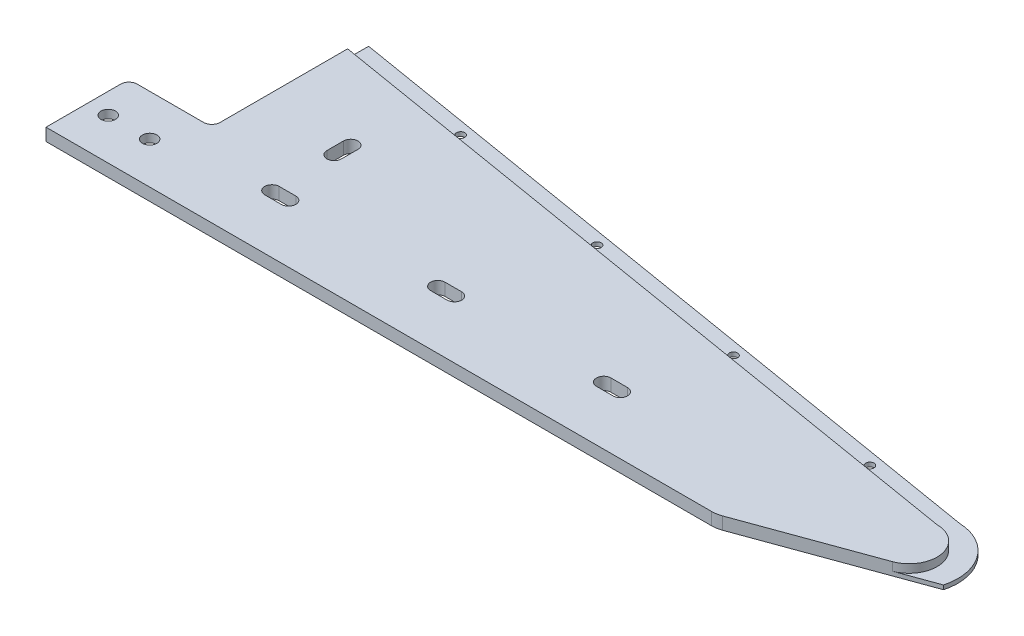
from build123d import *

# Parameters (mm, degrees)
SKETCH_1_W                = 35
SKETCH_1_H                = 55
EXTRUDE_1_DEPTH           = 1
EXTRUDE_2_DEPTH           = 3
SKETCH_3_R                = 5
CUT_EXTRUDE_1_DEPTH       = 169.569903897
SKETCH_4_R                = 4
CUT_EXTRUDE_2_DEPTH       = 2
SKETCH_5_R                = 2
CUT_EXTRUDE_3_DEPTH       = 2
EXTRUDE_START             = 7
EXTRUDE_3_DEPTH           = 7
CUT_EXTRUDE_START         = -1.5
SKETCH_9_W                = 10
SKETCH_9_H                = 26
CUT_EXTRUDE_4_DEPTH       = 168.318874833
SKETCH_10_R               = 1.5
CUT_EXTRUDE_5_DEPTH       = 194.595583627
EXTRUDE_4_DEPTH           = 3
SKETCH_13_W               = 334.012533363
SKETCH_13_H               = 161.456209481
CUT_EXTRUDE_6_DEPTH       = 10
SKETCH_14_R               = 3.5
CUT_EXTRUDE_7_DEPTH       = 2.5
SKETCH_15_R               = 5
CUT_EXTRUDE_8_DEPTH       = 179.854165453
EXTRUDE_START_2           = 16
EXTRUDE_5_DEPTH           = 16
EXTRUDE_6_DEPTH           = 7
SKETCH_19_W               = 10
SKETCH_19_H               = 26
CUT_EXTRUDE_9_DEPTH       = 180.209193181
SKETCH_20_R               = 1.5
CUT_EXTRUDE_10_DEPTH      = 175.844216376
THREAD_1_PITCH            = 0.6
CUT_EXTRUDE_11_DEPTH      = 181.709193232
SKETCH_22_W               = 13
SKETCH_22_H               = 1.5
CUT_EXTRUDE_12_DEPTH      = 7
SKETCH_23_R               = 5
EXTRUDE_7_DEPTH           = 2
CUT_EXTRUDE_START_2       = -3
CUT_EXTRUDE_15_DEPTH      = 177.762490825
SKETCH_25_R               = 7.5
CUT_EXTRUDE_16_DEPTH      = 4
CUT_EXTRUDE_17_DEPTH      = 10
SKETCH_27_R               = 1.75
CUT_EXTRUDE_18_DEPTH      = 10
CUT_EXTRUDE_19_DEPTH      = 180.762490825
CUT_EXTRUDE_19_DEPTH_BACK = 60
CUT_EXTRUDE_20_DEPTH      = 2
SKETCH_30_W               = 11.653427307
SKETCH_30_H               = 7.287785495
CUT_EXTRUDE_21_DEPTH      = 193.522031886
SKETCH_31_W               = 3.751946438
SKETCH_31_H               = 6.76496914
CUT_EXTRUDE_22_DEPTH      = 10
SKETCH_32_R               = 1
CUT_EXTRUDE_23_DEPTH      = 10
SKETCH_33_R               = 6.599468503
EXTRUDE_8_DEPTH           = 1
SKETCH_34_W               = 94.741371682
SKETCH_34_H               = 17.469135828
CUT_EXTRUDE_25_DEPTH      = 330
SKETCH_35_W               = 20
SKETCH_35_H               = 3
EXTRUDE_9_DEPTH           = 20
SKETCH_36_R               = 1.75
CUT_EXTRUDE_26_DEPTH      = 20
SKETCH_37_R               = 3.5
CUT_EXTRUDE_27_DEPTH      = 1
FILLET_1_R                = 2


with BuildPart() as part:
    # Sketch 1 → 凸台-拉伸1 (new body)
    with BuildSketch(Plane(origin=(0, 0, 0), x_dir=(1, 0, 0), z_dir=(0, 1, 0))):
        Rectangle(SKETCH_1_W, SKETCH_1_H)
    extrude(amount=EXTRUDE_1_DEPTH)

    # 草图2 → 凸台-拉伸2 (add)
    with BuildSketch(Plane(origin=(0, 1, 0), x_dir=(1, 0, 0), z_dir=(0, 1, 0))):
        with BuildLine():
            Line((106.75, -2.25), (106.75, 2.25))
            Line((106.75, 2.25), (121.75, 2.25))
            ThreePointArc((121.75, 2.25), (122.922125199, 2.352547667), (124.058635967, 2.65707481))
            Line((124.058635967, 2.65707481), (154.058635967, 13.576181838))
            ThreePointArc((154.058635967, 13.576181838), (158.397452333, 21.091232227), (151.75, 26.669107028))
            Line((151.75, 26.669107028), (-31.447415548, 57.101298968))
            ThreePointArc((-31.447415548, 57.101298968), (-37.800418235, 56.264673928), (-42.609265279, 52.029632639))
            Line((-42.609265279, 52.029632639), (-60.161792173, 23.605896086))
            ThreePointArc((-60.161792173, 23.605896086), (-61.717833724, 20.073278016), (-62.25, 16.25))
            Line((-62.25, 16.25), (-62.25, -16.25))
            ThreePointArc((-62.25, -16.25), (-61.717833724, -20.073278016), (-60.161792173, -23.605896086))
            Line((-60.161792173, -23.605896086), (-42.609265279, -52.029632639))
            ThreePointArc((-42.609265279, -52.029632639), (-37.800418235, -56.264673928), (-31.447415548, -57.101298968))
            Line((-31.447415548, -57.101298968), (151.75, -26.669107028))
            ThreePointArc((151.75, -26.669107028), (158.397452333, -21.091232227), (154.058635967, -13.576181838))
            Line((154.058635967, -13.576181838), (124.058635967, -2.65707481))
            ThreePointArc((124.058635967, -2.65707481), (122.922125199, -2.352547667), (121.75, -2.25))
            Line((121.75, -2.25), (106.75, -2.25))
        make_face()
    extrude(amount=EXTRUDE_2_DEPTH)

    # 草图3 → 切除-拉伸1 (cut, through all)
    with BuildSketch(Plane(origin=(0, 4, 0), x_dir=(1, 0, 0), z_dir=(0, 1, 0))):
        with Locations(Location((-48.25, 16.25, 0), (0, 0, 270))):
            Circle(SKETCH_3_R)
        with Locations(Location((-48.25, -16.25, 0), (0, 0, 270))):
            Circle(SKETCH_3_R)
    extrude(amount=-CUT_EXTRUDE_1_DEPTH, mode=Mode.SUBTRACT)

    # 草图4 → 切除-拉伸2 (cut)
    with BuildSketch(Plane(origin=(0, 4, 0), x_dir=(1, 0, 0), z_dir=(0, 1, 0))):
        with Locations(Location((-33.25, 46.25, 0), (0, 0, 270))):
            Circle(SKETCH_4_R)
        with Locations(Location((-33.25, -46.25, 0), (0, 0, 270))):
            Circle(SKETCH_4_R)
    extrude(amount=-CUT_EXTRUDE_2_DEPTH, mode=Mode.SUBTRACT)

    # 草图5 → 切除-拉伸3 (cut)
    with BuildSketch(Plane(origin=(0, 4, 0), x_dir=(1, 0, 0), z_dir=(0, 1, 0))):
        with Locations(Location((121.75, 9, 0), (0, 0, 270))):
            Circle(SKETCH_5_R)
        with Locations(Location((121.75, -9, 0), (0, 0, 270))):
            Circle(SKETCH_5_R)
        with Locations(Location((151.75, 19.919107028, 0), (0, 0, 270))):
            Circle(SKETCH_5_R)
        with Locations(Location((151.75, -19.919107028, 0), (0, 0, 270))):
            Circle(SKETCH_5_R)
    extrude(amount=-CUT_EXTRUDE_3_DEPTH, mode=Mode.SUBTRACT)

    # 草图8 → 凸台-拉伸3 (add)
    with BuildSketch(Plane.XZ.offset(-1).offset(EXTRUDE_START)):
        with BuildLine():
            Line((-26.75, -26.25), (-39.75, -26.25))
            Line((-39.75, -26.25), (-39.75, -55.124119675))
            ThreePointArc((-39.75, -55.124119675), (-35.798281322, -56.950759894), (-31.447415548, -57.101298968))
            Line((-31.447415548, -57.101298968), (-26.75, -56.320978726))
            Line((-26.75, -56.320978726), (-26.75, -26.25))
        make_face()
    extrude_3 = extrude(amount=-EXTRUDE_3_DEPTH)

    # 镜向1: 凸台-拉伸3 across plane
    add(extrude_3.mirror(Plane.XY))

    # 草图9 → 切除-拉伸4 (cut, through all)
    with BuildSketch(Plane.XZ.offset(6).offset(CUT_EXTRUDE_START)):
        with Locations((-33.25, -40.75)):
            Rectangle(SKETCH_9_W, SKETCH_9_H)
    cut_extrude_4 = extrude(amount=-CUT_EXTRUDE_4_DEPTH, mode=Mode.SUBTRACT)

    # 镜向2: 切除-拉伸4 across plane
    add(cut_extrude_4.mirror(Plane.XY), mode=Mode.SUBTRACT)

    # 草图10 → 切除-拉伸5 (cut, through all)
    with BuildSketch(Plane.XY.offset(-53.75)):
        with Locations((-33.25, -1.5)):
            Circle(SKETCH_10_R)
    cut_extrude_5 = extrude(amount=-CUT_EXTRUDE_5_DEPTH, mode=Mode.SUBTRACT)

    # 镜向3: 切除-拉伸5 across plane
    add(cut_extrude_5.mirror(Plane.XY), mode=Mode.SUBTRACT)

    # 草图12 → 凸台-拉伸4 (add)
    with BuildSketch(Plane(origin=(0, 4, 0), x_dir=(1, 0, 0), z_dir=(0, 1, 0))):
        with BuildLine():
            Line((152.536154407, 34.648141662), (-30.136445037, 64.993152763))
            ThreePointArc((-30.136445037, 64.993152763), (-32.296727103, 65.226071005), (-34.469475839, 65.210824842))
            Line((-34.469475839, 65.210824842), (-60.161792173, 23.605896086))
            ThreePointArc((-60.161792173, 23.605896086), (-61.717833724, 20.073278016), (-62.25, 16.25))
            Line((-62.25, 16.25), (-62.25, 2.25))
            Line((-62.25, 2.25), (121.75, 2.25))
            ThreePointArc((121.75, 2.25), (122.922125199, 2.352547667), (124.058635967, 2.65707481))
            Line((124.058635967, 2.65707481), (166.382589153, 18.061733966))
            ThreePointArc((166.382589153, 18.061733966), (163.073058037, 29.371665237), (152.536154407, 34.648141662))
        make_face()
    extrude(amount=EXTRUDE_4_DEPTH)

    # 草图13 → 切除-拉伸6 (cut)
    with BuildSketch(Plane.XZ.offset(-4)):
        with Locations((47.836319436, 6.16656882)):
            Rectangle(SKETCH_13_W, SKETCH_13_H)
    extrude(amount=CUT_EXTRUDE_6_DEPTH, mode=Mode.SUBTRACT)

    # 草图14 → 切除-拉伸7 (cut)
    with BuildSketch(Plane.XZ.offset(-4)):
        with Locations(Location((151.75, -19.919107028, 0), (0, 0, 270))):
            Circle(SKETCH_14_R)
        with Locations(Location((121.75, -9, 0), (0, 0, 270))):
            Circle(SKETCH_14_R)
    extrude(amount=-CUT_EXTRUDE_7_DEPTH, mode=Mode.SUBTRACT)

    # 草图15 → 切除-拉伸8 (cut, through all)
    with BuildSketch(Plane.XZ.offset(-4)):
        with Locations(Location((-48.25, -16.25, 0), (0, 0, 270))):
            Circle(SKETCH_15_R)
    extrude(amount=-CUT_EXTRUDE_8_DEPTH, mode=Mode.SUBTRACT)

    # 草图17 → 凸台-拉伸5 (add)
    with BuildSketch(Plane.XZ.offset(-4).offset(EXTRUDE_START_2)):
        with BuildLine():
            Line((-30.628058978, -62.03370759), (152.218782473, -31.659751942))
            ThreePointArc((152.218782473, -31.659751942), (161.216553887, -26.879484712), (163.096310198, -16.865626245))
            Line((163.096310198, -16.865626245), (166.382589153, -18.061733966))
            ThreePointArc((166.382589153, -18.061733966), (163.073058037, -29.371665237), (152.536154407, -34.648141662))
            Line((152.536154407, -34.648141662), (-30.136445037, -64.993152763))
            ThreePointArc((-30.136445037, -64.993152763), (-32.296727103, -65.226071005), (-34.469475839, -65.210824842))
            Line((-34.469475839, -65.210824842), (-36.504423199, -61.915526791))
            ThreePointArc((-36.504423199, -61.915526791), (-33.571714316, -62.246765295), (-30.628058978, -62.03370759))
        make_face()
    extrude(amount=-EXTRUDE_5_DEPTH)

    # 草图18 → 凸台-拉伸6 (add)
    with BuildSketch(Plane(origin=(0, 7, 0), x_dir=(1, 0, 0), z_dir=(0, 1, 0))):
        with BuildLine():
            Line((-39.75, 56.65979236), (-39.75, 26.25))
            Line((-39.75, 26.25), (-26.75, 26.25))
            Line((-26.75, 26.25), (-26.75, 64.430606916))
            Line((-26.75, 64.430606916), (-30.136445037, 64.993152763))
            ThreePointArc((-30.136445037, 64.993152763), (-32.296727103, 65.226071005), (-34.469475839, 65.210824842))
            Line((-34.469475839, 65.210824842), (-39.75, 56.65979236))
        make_face()
    extrude(amount=EXTRUDE_6_DEPTH)

    # 草图19 → 切除-拉伸9 (cut, through all)
    with BuildSketch(Plane(origin=(0, 14, 0), x_dir=(1, 0, 0), z_dir=(0, 1, 0)).offset(CUT_EXTRUDE_START)):
        with Locations((-33.25, 40.75)):
            Rectangle(SKETCH_19_W, SKETCH_19_H)
    extrude(amount=-CUT_EXTRUDE_9_DEPTH, mode=Mode.SUBTRACT)

    # 草图20 → 切除-拉伸10 (cut, through all)
    with BuildSketch(Plane.XY.offset(-53.75)):
        with Locations((-33.25, 9.5)):
            Circle(SKETCH_20_R)
    extrude(amount=-CUT_EXTRUDE_10_DEPTH, mode=Mode.SUBTRACT)

    # 螺纹线1: the profile of Sketch 1 2 profile screwed along a right-hand helix of 25 turns, 6 arcs to a turn; built about Z, then put on its axis
    thread_1_z = Axis((0, 0, 0), (0, 0, 1))
    thread_1_corners = [(1.4997, 0, -0.000173205), (1.824759525, 0, 0.187499999), (1.824759525, 0, 0.262499999), (1.4997, 0, 0.450173203)]
    with BuildLine(mode=Mode.PRIVATE) as thread_1_profile:
        Line(thread_1_corners[0], thread_1_corners[1])
        Line(thread_1_corners[1], thread_1_corners[2])
        Line(thread_1_corners[2], thread_1_corners[3])
        Line(thread_1_corners[3], thread_1_corners[0])
    thread_1_cap = Face(thread_1_profile.wire())
    thread_1_turn_angles = [0, 30, 60, 90, 120, 150, 180, 210, 240, 270, 300, 330, 360]
    thread_1_turn_weights = [1, 0.8660254037844387, 1, 0.8660254037844387, 1, 0.8660254037844387, 1, 0.8660254037844387, 1, 0.8660254037844387, 1, 0.8660254037844387, 1]
    thread_1_turn_rails = [Edge.make_bspline([Vector(p[0], p[1], 0).rotate(thread_1_z, thread_1_turn_angles[k]) / thread_1_turn_weights[k] + Vector(0, 0, p[2] + THREAD_1_PITCH * thread_1_turn_angles[k] / 360) for k in range(13)], [0, 0, 0, 1, 1, 2, 2, 3, 3, 4, 4, 5, 5, 6, 6, 6], 2, thread_1_turn_weights) for p in thread_1_corners]
    thread_1_turn_sides = [Face.make_surface_from_curves(thread_1_turn_rails[p[0]], thread_1_turn_rails[p[1]]) for p in [(0, 1), (1, 2), (2, 3), (3, 0)]]
    thread_1 = Plane(origin=(-33.25, 9.5, -53.75), x_dir=(-1, 0, 0), z_dir=(0, 0, -1)) * Solid(Shell([*[p.moved(Location((0, 0, THREAD_1_PITCH * i))) for i in range(25) for p in thread_1_turn_sides], thread_1_cap, thread_1_cap.rotate(thread_1_z, 9000).moved(Location((0, 0, THREAD_1_PITCH * 9000 / 360)))]))
    add(thread_1, mode=Mode.SUBTRACT)

    # 草图21 → 切除-拉伸11 (cut, through all)
    with BuildSketch(Plane(origin=(0, 14, 0), x_dir=(1, 0, 0), z_dir=(0, 1, 0))):
        with BuildLine():
            Line((-39.75, 27.75), (-26.75, 27.75))
            Line((-26.75, 27.75), (-26.75, 64.430606916))
            Line((-26.75, 64.430606916), (-30.136445037, 64.993152763))
            ThreePointArc((-30.136445037, 64.993152763), (-32.296727103, 65.226071005), (-34.469475839, 65.210824842))
            Line((-34.469475839, 65.210824842), (-39.75, 56.65979236))
            Line((-39.75, 56.65979236), (-39.75, 27.75))
        make_face()
    extrude(amount=-CUT_EXTRUDE_11_DEPTH, mode=Mode.SUBTRACT)

    # 草图22 → 切除-拉伸12 (cut)
    with BuildSketch(Plane(origin=(0, 14, 0), x_dir=(1, 0, 0), z_dir=(0, 1, 0))):
        with Locations((-33.25, 27)):
            Rectangle(SKETCH_22_W, SKETCH_22_H)
    extrude(amount=-CUT_EXTRUDE_12_DEPTH, mode=Mode.SUBTRACT)

    # 草图23 → 凸台-拉伸7 (add)
    with BuildSketch(Plane(origin=(0, 7, 0), x_dir=(1, 0, 0), z_dir=(0, 1, 0))):
        with BuildLine():
            Line((-26.75, 27.75), (-39.75, 27.75))
            Line((-39.75, 27.75), (-39.75, 56.65979236))
            Line((-39.75, 56.65979236), (-60.161792173, 23.605896086))
            ThreePointArc((-60.161792173, 23.605896086), (-61.717833724, 20.073278016), (-62.25, 16.25))
            Line((-62.25, 16.25), (-62.25, 2.25))
            Line((-62.25, 2.25), (-18.75, 2.25))
            Line((-18.75, 2.25), (-18.75, 63.101671489))
            Line((-18.75, 63.101671489), (-26.75, 64.430606916))
            Line((-26.75, 64.430606916), (-26.75, 27.75))
        make_face()
        with Locations(Location((-48.25, 16.25, 0), (0, 0, 90))):
            Circle(SKETCH_23_R, mode=Mode.SUBTRACT)
    extrude(amount=EXTRUDE_7_DEPTH)

    # 草图24 → 切除-拉伸15 (cut, through all)
    with BuildSketch(Plane(origin=(0, 9, 0), x_dir=(1, 0, 0), z_dir=(0, 1, 0)).offset(CUT_EXTRUDE_START_2)):
        Polygon((-45.75, 46.034880297), (-45.75, 27.75), (-39.75, 27.75), (-39.75, 56.65979236), (-45.75, 46.943674541), align=None)
        Polygon((-26.75, 64.430606916), (-26.75, 27.75), (-20.75, 27.75), (-20.75, 63.433905346), align=None)
    extrude(amount=-CUT_EXTRUDE_15_DEPTH, mode=Mode.SUBTRACT)

    # 草图25 → 切除-拉伸16 (cut)
    with BuildSketch(Plane.XZ.offset(-4)):
        with Locations(Location((-48.25, -16.25, 0), (0, 0, 270))):
            Circle(SKETCH_25_R)
    extrude(amount=-CUT_EXTRUDE_16_DEPTH, mode=Mode.SUBTRACT)

    # 草图26 → 切除-拉伸17 (cut)
    with BuildSketch(Plane(origin=(0, 7, 0), x_dir=(1, 0, 0), z_dir=(0, 1, 0))):
        with BuildLine():
            Line((3.5, 31.25), (3.5, 35.25))
            ThreePointArc((3.5, 35.25), (1.75, 37), (0, 35.25))
            Line((0, 35.25), (0, 31.25))
            ThreePointArc((0, 31.25), (1.75, 29.5), (3.5, 31.25))
        make_face()
        with BuildLine():
            ThreePointArc((41.75, 18), (40.512563133, 17.487436867), (40, 16.25))
            Line((40, 16.25), (47.5, 16.25))
            ThreePointArc((47.5, 16.25), (46.987436867, 17.487436867), (45.75, 18))
            Line((45.75, 18), (41.75, 18))
        make_face()
        with BuildLine():
            Line((47.5, 16.25), (40, 16.25))
            ThreePointArc((40, 16.25), (40.512563133, 15.012563133), (41.75, 14.5))
            Line((41.75, 14.5), (45.75, 14.5))
            ThreePointArc((45.75, 14.5), (46.987436867, 15.012563133), (47.5, 16.25))
        make_face()
        with BuildLine():
            Line((81.75, 14.5), (85.75, 14.5))
            ThreePointArc((85.75, 14.5), (87.5, 16.25), (85.75, 18))
            Line((85.75, 18), (81.75, 18))
            ThreePointArc((81.75, 18), (80, 16.25), (81.75, 14.5))
        make_face()
        with BuildLine():
            Line((1.75, 18), (5.75, 18))
            ThreePointArc((5.75, 18), (7.5, 16.25), (5.75, 14.5))
            Line((5.75, 14.5), (1.75, 14.5))
            ThreePointArc((1.75, 14.5), (0, 16.25), (1.75, 18))
        make_face()
    extrude(amount=-CUT_EXTRUDE_17_DEPTH, mode=Mode.SUBTRACT)

    # 草图27 → 切除-拉伸18 (cut)
    with BuildSketch(Plane.XZ.offset(-6)):
        with Locations(Location((-42.75, -32.75, 0), (0, 0, 270))):
            Circle(SKETCH_27_R)
        with Locations(Location((-42.75, -42.75, 0), (0, 0, 270))):
            Circle(SKETCH_27_R)
        with Locations(Location((-23.75, -32.75, 0), (0, 0, 270))):
            Circle(SKETCH_27_R)
        with Locations(Location((-23.75, -42.75, 0), (0, 0, 270))):
            Circle(SKETCH_27_R)
    extrude(amount=-CUT_EXTRUDE_18_DEPTH, mode=Mode.SUBTRACT)

    # 草图28 → 切除-拉伸19 (cut, two sides: drawn at the far end of the back side and taken through both)
    with BuildSketch(Plane.XZ.offset(12).offset(-CUT_EXTRUDE_19_DEPTH_BACK)):
        with BuildLine():
            Line((152.218782473, -31.659751942), (-20.75, -60.392794775))
            Line((-20.75, -60.392794775), (-20.75, -63.433905346))
            Line((-20.75, -63.433905346), (152.536154407, -34.648141662))
            ThreePointArc((152.536154407, -34.648141662), (163.073058037, -29.371665237), (166.382589153, -18.061733966))
            Line((166.382589153, -18.061733966), (163.096310198, -16.865626245))
            ThreePointArc((163.096310198, -16.865626245), (161.216553887, -26.879484712), (152.218782473, -31.659751942))
        make_face()
        Polygon((-26.75, -61.389496345), (-26.75, -64.430606916), (-20.75, -63.433905346), (-20.75, -60.392794775), align=None)
    extrude(amount=CUT_EXTRUDE_19_DEPTH + CUT_EXTRUDE_19_DEPTH_BACK, mode=Mode.SUBTRACT)

    # 草图29 → 切除-拉伸20 (cut)
    with BuildSketch(Plane.XZ.offset(-4).offset(CUT_EXTRUDE_START_2)):
        with BuildLine():
            Line((-18.75, -60.060560918), (152.218782473, -31.659751942))
            ThreePointArc((152.218782473, -31.659751942), (161.216553887, -26.879484712), (163.096310198, -16.865626245))
            Line((163.096310198, -16.865626245), (154.058635967, -13.576181838))
            ThreePointArc((154.058635967, -13.576181838), (158.397452333, -21.091232227), (151.75, -26.669107028))
            Line((151.75, -26.669107028), (-18.75, -54.9920433))
            Line((-18.75, -54.9920433), (-18.75, -60.060560918))
        make_face()
    extrude(amount=CUT_EXTRUDE_20_DEPTH, mode=Mode.SUBTRACT)

    # 草图30 → 切除-拉伸21 (cut, through all)
    with BuildSketch(Plane(origin=(-18.75, 0, 0), x_dir=(0, 0, -1), z_dir=(1, 0, 0))):
        with Locations((60.818756954, 8.643892748)):
            Rectangle(SKETCH_30_W, SKETCH_30_H)
    extrude(amount=-CUT_EXTRUDE_21_DEPTH, mode=Mode.SUBTRACT)

    # 草图31 → 切除-拉伸22 (cut)
    with BuildSketch(Plane(origin=(0, 5, 0), x_dir=(1, 0, 0), z_dir=(0, 1, 0))):
        with Locations((-20.625973219, 58.37452787)):
            Rectangle(SKETCH_31_W, SKETCH_31_H)
    extrude(amount=-CUT_EXTRUDE_22_DEPTH, mode=Mode.SUBTRACT)

    # 草图32 → 切除-拉伸23 (cut)
    with BuildSketch(Plane(origin=(0, 5, 0), x_dir=(1, 0, 0), z_dir=(0, 1, 0))):
        with BuildLine():
            ThreePointArc((11.886282262, 52.603213934), (10.968496238, 53.599828635), (9.899800538, 52.767085248))
            Line((9.899800538, 52.767085248), (11.872763986, 52.43934262))
            ThreePointArc((11.872763986, 52.43934262), (11.882896963, 52.520999958), (11.886282262, 52.603213934))
        make_face()
        with BuildLine():
            Line((11.872763986, 52.43934262), (9.899800538, 52.767085248))
            ThreePointArc((9.899800538, 52.767085248), (10.722410948, 51.61673221), (11.872763986, 52.43934262))
        make_face()
        with BuildLine():
            ThreePointArc((51.345551236, 46.04836138), (50.427765212, 47.044976081), (49.359069512, 46.212232694))
            Line((49.359069512, 46.212232694), (51.332032961, 45.884490066))
            ThreePointArc((51.332032961, 45.884490066), (51.342165937, 45.966147404), (51.345551236, 46.04836138))
        make_face()
        with BuildLine():
            Line((51.332032961, 45.884490066), (49.359069512, 46.212232694))
            ThreePointArc((49.359069512, 46.212232694), (50.181679923, 45.061879655), (51.332032961, 45.884490066))
        make_face()
        with Locations(Location((89.804820211, 39.493508826, 0), (0, 0, 270))):
            Circle(SKETCH_32_R)
        with Locations(Location((129.264089185, 32.938656271, 0), (0, 0, 270))):
            Circle(SKETCH_32_R)
    extrude(amount=-CUT_EXTRUDE_23_DEPTH, mode=Mode.SUBTRACT)

    # 草图33 → 凸台-拉伸8 (add)
    with BuildSketch(Plane(origin=(0, 9, 0), x_dir=(1, 0, 0), z_dir=(0, 1, 0))):
        with Locations((-48.25, 16.25)):
            Circle(SKETCH_33_R)
    extrude(amount=-EXTRUDE_8_DEPTH)

    # 草图34 → 切除-拉伸25 (cut)
    with BuildSketch(Plane(origin=(-18.75, 0, 0), x_dir=(0, 0, -1), z_dir=(1, 0, 0))):
        with Locations((27.138654338, 6.617464179)):
            Rectangle(SKETCH_34_W, SKETCH_34_H)
    extrude(amount=-CUT_EXTRUDE_25_DEPTH, mode=Mode.SUBTRACT)

    # 草图35 → 凸台-拉伸9 (add)
    with BuildSketch(Plane.ZY.offset(18.75)):
        with Locations((-12.25, 5.5)):
            Rectangle(SKETCH_35_W, SKETCH_35_H)
    extrude(amount=EXTRUDE_9_DEPTH)

    # 草图36 → 切除-拉伸26 (cut)
    with BuildSketch(Plane.XZ.offset(-4)):
        with BuildLine():
            ThreePointArc((-22, -12.25), (-23.75, -10.5), (-25.5, -12.25))
            Line((-25.5, -12.25), (-22, -12.25))
        make_face()
        with BuildLine():
            Line((-22, -12.25), (-25.5, -12.25))
            ThreePointArc((-25.5, -12.25), (-23.75, -14), (-22, -12.25))
        make_face()
        with Locations(Location((-33.75, -12.25, 0), (0, 0, 270))):
            Circle(SKETCH_36_R)
    extrude(amount=-CUT_EXTRUDE_26_DEPTH, mode=Mode.SUBTRACT)

    # 草图37 → 切除-拉伸27 (cut)
    with BuildSketch(Plane.XZ.offset(-4)):
        with Locations(Location((-33.75, -12.25, 0), (0, 0, 270))):
            Circle(SKETCH_37_R)
        with Locations(Location((-23.75, -12.25, 0), (0, 0, 270))):
            Circle(SKETCH_37_R)
    extrude(amount=-CUT_EXTRUDE_27_DEPTH, mode=Mode.SUBTRACT)

    # 圆角1
    fillet_1_edges = [part.edges().sort_by_distance(p)[0] for p in [
        (-18.75, 5.5, -22.25),
        (-38.75, 5.5, -22.25),
    ]]
    fillet(fillet_1_edges, radius=FILLET_1_R)


solid = part.part
